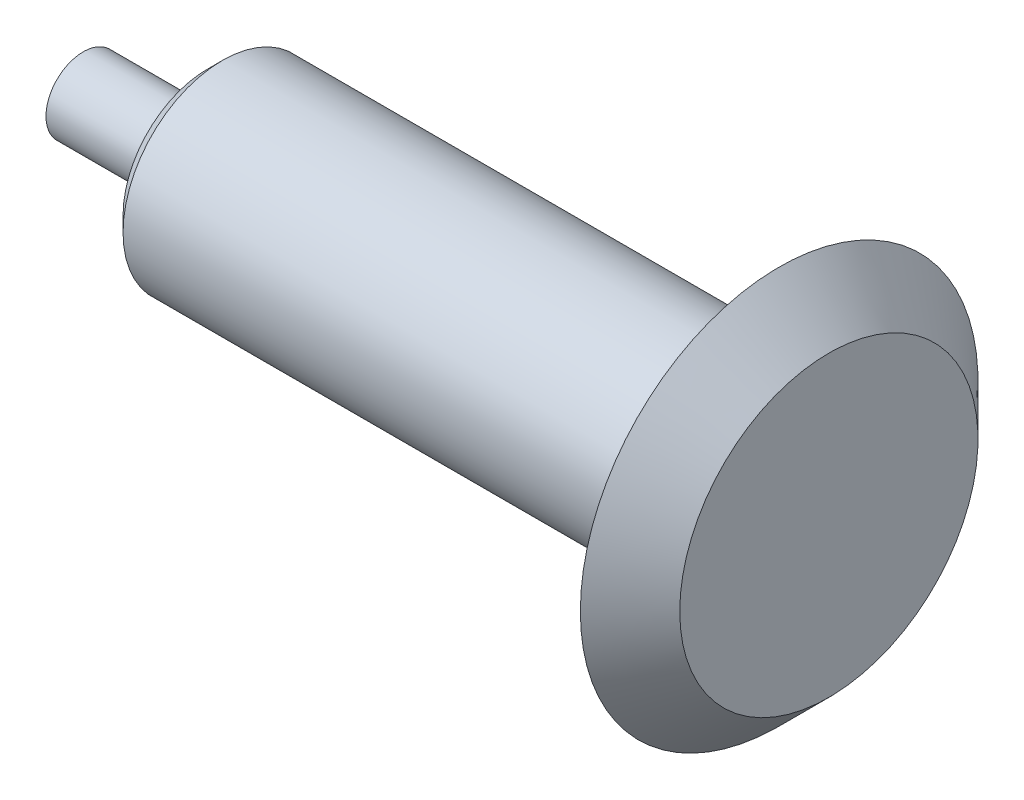
from build123d import *

# Parameters (mm, degrees)
SKETCH_1_W     = 25
SKETCH_1_H     = 7.5
SKETCH_1_W_2   = 10
SKETCH_1_H_2   = 40
CHAMFER_1_SIZE = 10
CHAMFER_2_SIZE = 10
CHAMFER_3_SIZE = 3


with BuildPart() as part:
    # 草圖1 → 迴轉1 (revolve)
    with BuildSketch(Plane.XY, mode=Mode.PRIVATE) as revolve_1_sk:
        with Locations((12.5, 3.75)):
            Rectangle(SKETCH_1_W, SKETCH_1_H)
        with Locations((145, 20)):
            Rectangle(SKETCH_1_W_2, SKETCH_1_H_2)
        Polygon((25, 7.5), (25, 0), (140, 0), (140, 20), (25, 20), align=None)
    revolve(revolve_1_sk.sketch.rotate(Axis((25, 0, 0), (1, 0, 0)), 90), axis=Axis((25, 0, 0), (1, 0, 0)))

    # 倒角1
    chamfer_1_edges = [part.edges().sort_by_distance(p)[0] for p in [
        (150, 0, -40),
    ]]
    chamfer(chamfer_1_edges, length=CHAMFER_1_SIZE - 0.0001)  # a hair under: the kernel refuses the full size

    # 倒角2
    chamfer_2_edges = [part.edges().sort_by_distance(p)[0] for p in [
        (140, 0, -20),
    ]]
    chamfer(chamfer_2_edges, length=CHAMFER_2_SIZE)

    # 倒角3
    chamfer_3_edges = [part.edges().sort_by_distance(p)[0] for p in [
        (25, 0, -20),
    ]]
    chamfer(chamfer_3_edges, length=CHAMFER_3_SIZE)


solid = part.part
